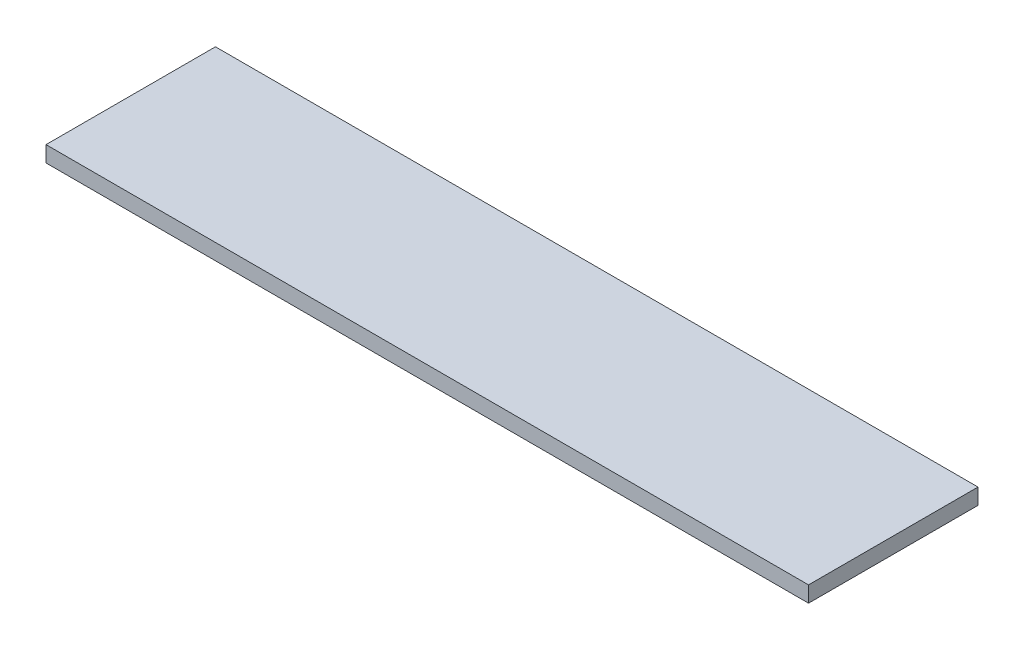
from build123d import *

# Parameters (mm, degrees)
SKETCH1_W           = 457.2
SKETCH1_H           = 101.6
BOSS_EXTRUDE1_DEPTH = 9.525


with BuildPart() as part:
    # Sketch1 → Boss-Extrude1 (new body)
    with BuildSketch(Plane(origin=(0, 0, 0), x_dir=(1, 0, 0), z_dir=(0, 1, 0))):
        with Locations((228.6, 50.8)):
            Rectangle(SKETCH1_W, SKETCH1_H)
    extrude(amount=BOSS_EXTRUDE1_DEPTH)


solid = part.part
